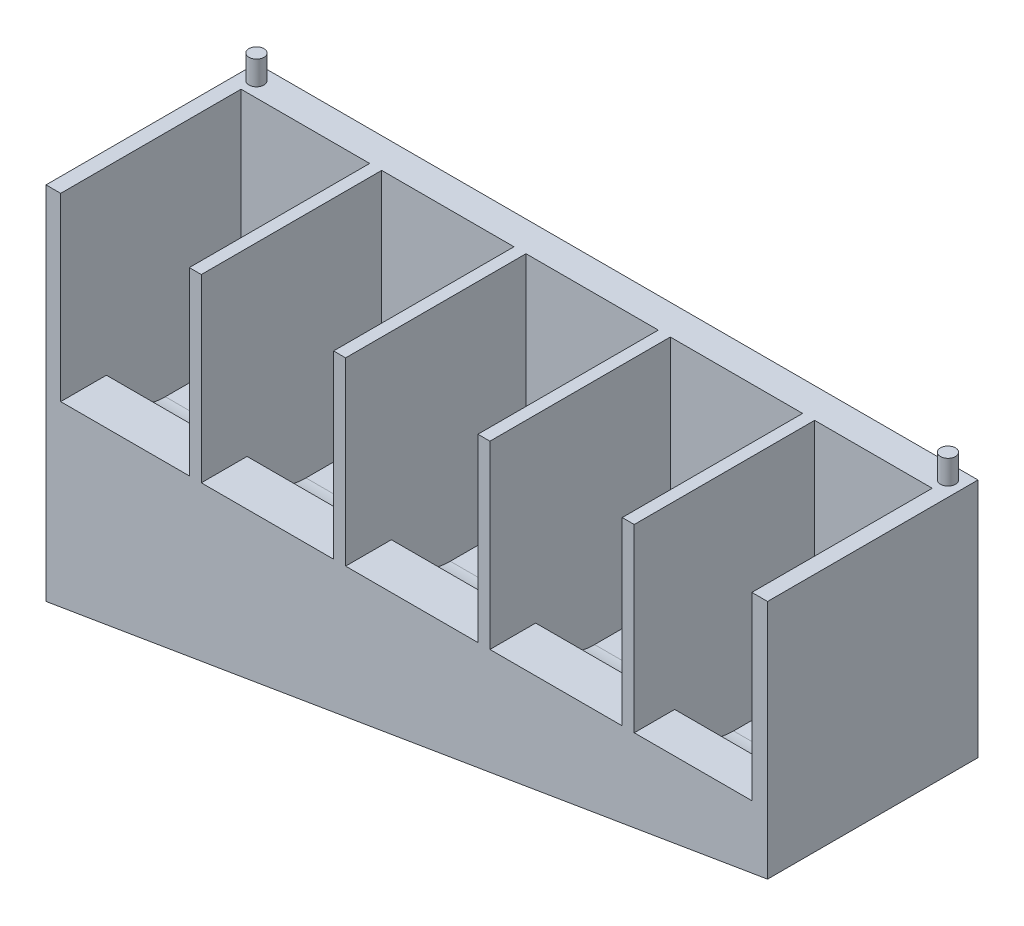
from build123d import *

# Parameters (mm, degrees)
SKETCH1_W           = 120
SKETCH1_H           = 35
BOSS_EXTRUDE1_DEPTH = 40
SKETCH2_W           = 21.39
SKETCH2_H           = 30
SKETCH2_W_2         = 22
SKETCH2_W_3         = 19.56
CUT_EXTRUDE1_DEPTH  = 30
SKETCH3_W           = 21.39
SKETCH3_H           = 22.392557851
SKETCH3_W_2         = 22
SKETCH3_W_3         = 19.56
SKETCH3_H_2         = 23.276606707
CUT_EXTRUDE2_DEPTH  = 8
FILLET1_R           = 10
SKETCH4_R           = 1.25
BOSS_EXTRUDE2_DEPTH = 4
BOSS_EXTRUDE3_DEPTH = 35


with BuildPart() as part:
    # Sketch1 → Boss-Extrude1 (new body)
    with BuildSketch(Plane(origin=(0, 0, 0), x_dir=(1, 0, 0), z_dir=(0, 1, 0))):
        with Locations((18.660377358, 10.962264151)):
            Rectangle(SKETCH1_W, SKETCH1_H)
    extrude(amount=BOSS_EXTRUDE1_DEPTH)

    # Sketch2 → Cut-Extrude1 (cut)
    with BuildSketch(Plane(origin=(0, 40, 0), x_dir=(1, 0, 0), z_dir=(0, 1, 0))):
        with Locations((-28.204622642, 8.462264151)):
            Rectangle(SKETCH2_W, SKETCH2_H)
        with Locations((-4.509622642, 8.462264151)):
            Rectangle(SKETCH2_W_2, SKETCH2_H)
        with Locations((19.490377358, 8.462264151)):
            Rectangle(SKETCH2_W_2, SKETCH2_H)
        with Locations((43.490377358, 8.462264151)):
            Rectangle(SKETCH2_W_2, SKETCH2_H)
        with Locations((66.270377358, 8.462264151)):
            Rectangle(SKETCH2_W_3, SKETCH2_H)
    extrude(amount=-CUT_EXTRUDE1_DEPTH, mode=Mode.SUBTRACT)

    # Sketch3 → Cut-Extrude2 (cut)
    with BuildSketch(Plane(origin=(0, 10, 0), x_dir=(1, 0, 0), z_dir=(0, 1, 0))):
        with Locations((-28.204622642, 12.265985226)):
            Rectangle(SKETCH3_W, SKETCH3_H)
        with Locations((-4.509622642, 12.265985226)):
            Rectangle(SKETCH3_W_2, SKETCH3_H)
        with Locations((19.490377358, 12.265985226)):
            Rectangle(SKETCH3_W_2, SKETCH3_H)
        with Locations((43.490377358, 12.265985226)):
            Rectangle(SKETCH3_W_2, SKETCH3_H)
        with Locations((66.270377358, 11.823960798)):
            Rectangle(SKETCH3_W_3, SKETCH3_H_2)
    extrude(amount=-CUT_EXTRUDE2_DEPTH, mode=Mode.SUBTRACT)

    # Fillet1
    # the kernel refuses this fillet: 10 mm, written as the material it adds along each edge
    with BuildSketch(Plane(origin=(76.050377358, 2, -0.185657444), x_dir=(0, 0, -1), z_dir=(-1, 0, 0))) as fillet1_piece_1:
        with BuildLine():
            CenterArc((9.797958971, -10), FILLET1_R, 90, 78.463040967)
            Line((0, -8), (-0.195959179, -7.96))
            ThreePointArc((-0.195959179, -7.96), (-0.2, -4), (-0.2, 0))
            Line((-0.2, 0), (0, 0.2))
            Line((0, 0.2), (9.797958971, 0.2))
            Line((9.797958971, 0.2), (9.797958971, 0))
        make_face()
    extrude(amount=44.054897428)
    with BuildSketch(Plane(origin=(54.490377358, 2, -1.0697063), x_dir=(0, 1, 0), z_dir=(-1, 0, 0))) as fillet1_piece_2:
        with BuildLine():
            CenterArc((10, 9.797958971), FILLET1_R, 180, 78.463040967)
            Line((0, 9.797958971), (-0.2, 9.797958971))
            Line((-0.2, 9.797958971), (-0.2, 0))
            Line((-0.2, 0), (0, -0.2))
            ThreePointArc((0, -0.2), (4, -0.2), (7.96, -0.195959179))
            Line((7.96, -0.195959179), (8, 0))
        make_face()
    extrude(amount=46.494897428)
    with BuildSketch(Plane(origin=(54.985274786, 2, -1.0697063), x_dir=(0, 1, 0), z_dir=(-1, 0, 0))) as fillet1_piece_3:
        with BuildLine():
            CenterArc((10, 9.797958971), FILLET1_R, 180, 78.463040967)
            Line((0, 9.797958971), (-0.2, 9.797958971))
            Line((-0.2, 9.797958971), (-0.2, 0))
            Line((-0.2, 0), (0, -0.2))
            ThreePointArc((0, -0.2), (4, -0.2), (7.96, -0.195959179))
            Line((7.96, -0.195959179), (8, 0))
        make_face()
    extrude(amount=70.989794856)
    with BuildSketch(Plane(origin=(6.985274786, 2, -1.0697063), x_dir=(0, 1, 0), z_dir=(-1, 0, 0))) as fillet1_piece_4:
        with BuildLine():
            CenterArc((10, 9.797958971), FILLET1_R, 180, 78.463040967)
            Line((0, 9.797958971), (-0.2, 9.797958971))
            Line((-0.2, 9.797958971), (-0.2, 0))
            Line((-0.2, 0), (0, -0.2))
            ThreePointArc((0, -0.2), (4, -0.2), (7.96, -0.195959179))
            Line((7.96, -0.195959179), (8, 0))
        make_face()
    extrude(amount=45.884897428)
    with BuildSketch(Plane(origin=(30.985274786, 2, -1.0697063), x_dir=(0, 0, -1), z_dir=(-1, 0, 0))) as fillet1_piece_5:
        with BuildLine():
            CenterArc((9.797958971, -10), FILLET1_R, 90, 78.463040967)
            Line((0, -8), (-0.195959179, -7.96))
            ThreePointArc((-0.195959179, -7.96), (-0.2, -4), (-0.2, 0))
            Line((-0.2, 0), (0, 0.2))
            Line((0, 0.2), (9.797958971, 0.2))
            Line((9.797958971, 0.2), (9.797958971, 0))
        make_face()
    extrude(amount=70.989794856)

    # Sketch4 → Boss-Extrude2 (add)
    with BuildSketch(Plane(origin=(0, 40, 0), x_dir=(1, 0, 0), z_dir=(0, 1, 0))):
        with Locations(Location((-38.839622642, 25.962264151, 0), (0, 0, 90))):
            Circle(SKETCH4_R)
        with Locations(Location((76.160377358, 25.962264151, 0), (0, 0, 90))):
            Circle(SKETCH4_R)
    extrude(amount=BOSS_EXTRUDE2_DEPTH)

    # Sketch5 → Boss-Extrude3 (add)
    with BuildSketch(Plane.XY.offset(6.537735849)):
        Polygon((-41.339622642, 0), (-41.339622642, -20), (78.660377358, 0), align=None)
    extrude(amount=-BOSS_EXTRUDE3_DEPTH)


solid = part.part
